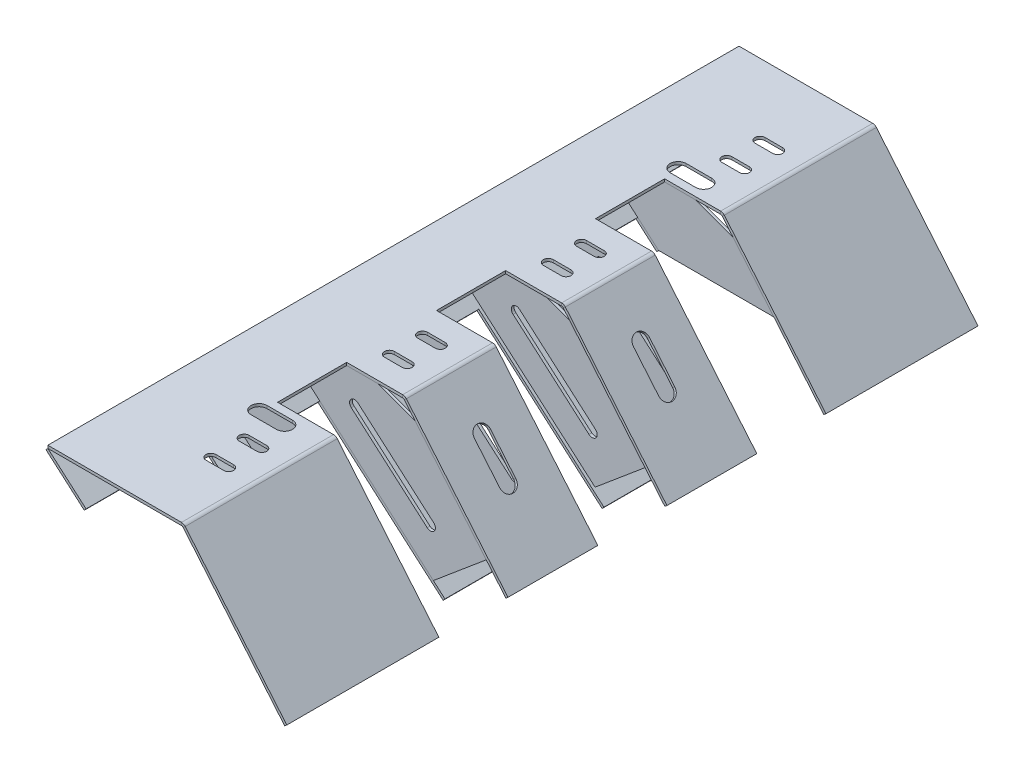
from build123d import *

# Parameters (mm, degrees)
SKETCH_1_W                  = 50
SKETCH_1_H                  = 250
SM_BASE_FLANGE_1_DEPTH      = 1
SM_START                    = -125
SM_EDGE_FLANGE_1_DEPTH      = 250
SM_EDGE_FLANGE_1_2_DEPTH    = 250
SKETCH_9_W                  = 58.348699919
SKETCH_9_H                  = 25
CUT_EXTRUDE_1_DEPTH         = 159.521065467
SM_BASE_FLANGE_2_DEPTH      = 1
SKETCH_20_W                 = 120
SKETCH_20_H                 = 250
SM_BASE_FLANGE_3_DEPTH      = 1
PATTERN_LINEAR_1_COUNT      = 2
PATTERN_LINEAR_1_PITCH      = 30.5
CUT_EXTRUDE_2_DEPTH         = 1
HOLE_START                  = -1
HOLE_WIZARD_M5_1_DEPTH      = 1
HOLE_WIZARD_M3_4_DEPTH      = 1
HOLE_WIZARD_M3_3_AT_2_COUNT = 2
HOLE_WIZARD_M3_3_AT_2_PITCH = 14.3
HOLE_START_2                = 36.659434546
HOLE_WIZARD_M5_3_DEPTH      = 1
SM_BASE_FLANGE_4_DEPTH      = 1
HOLE_START_3                = 44
HOLE_WIZARD_M3_10_DEPTH     = 1
PATTERN_START               = 13.5
PATTERN_LINEAR_2_DEPTH      = 1


# Read off the part's stored shape, not the designer's step: 边线-法兰1, M5 间隙槽口1, M3 间隙槽口4, M5 间隙槽口3, M3 间隙槽口10, 阵列(线性)2
# Sheet-metal steps are written as plain solids
with BuildPart() as part:
    # Sketch 1 → 基体-法兰1 (new body)
    with BuildSketch(Plane(origin=(0, 0, 0), x_dir=(1, 0, 0), z_dir=(0, 1, 0))):
        with Locations((25, 0)):
            Rectangle(SKETCH_1_W, SKETCH_1_H)
    extrude(amount=-SM_BASE_FLANGE_1_DEPTH)

    # 边线-法兰1 outline → 边线-法兰1 (cut)
    with BuildSketch(Plane.XY.offset(SM_START)):
        with BuildLine():
            ThreePointArc((48.35111049, 0), (49.085029363, -0.162705897), (49.68142327, -0.620335037))
            Line((49.68142327, -0.620335037), (50, -1))
            Line((50, -1), (50, 0))
            Line((50, 0), (48.35111049, 0))
        make_face()
    extrude(amount=SM_EDGE_FLANGE_1_DEPTH, mode=Mode.SUBTRACT)

    # Sm Edge Flange 1 2 outline → Sm Edge Flange 1 2 (add)
    with BuildSketch(Plane.XY.offset(SM_START)):
        with BuildLine():
            Line((86.442581731, -44.430577701), (50, -1))
            Line((50, -1), (48.35111049, -1))
            ThreePointArc((48.35111049, -1), (48.662411101, -1.069013684), (48.915378826, -1.263122647))
            Line((48.915378826, -1.263122647), (85.676537288, -45.073365311))
            Line((85.676537288, -45.073365311), (86.442581731, -44.430577701))
        make_face()
    extrude(amount=SM_EDGE_FLANGE_1_2_DEPTH)

    # Sketch 9 → 切除-拉伸1 (cut, through all)
    with BuildSketch(Plane(origin=(0, 0, 0), x_dir=(1, 0, 0), z_dir=(0, 1, 0))):
        with Locations((57.268231772, -57.5)):
            Rectangle(SKETCH_9_W, SKETCH_9_H)
        with Locations((57.268231772, 57.5)):
            Rectangle(SKETCH_9_W, SKETCH_9_H)
        with Locations((57.268231772, 0)):
            Rectangle(SKETCH_9_W, SKETCH_9_H)
    extrude(amount=-CUT_EXTRUDE_1_DEPTH, mode=Mode.SUBTRACT)

    # M5 间隙槽口1 outline → M5 间隙槽口1 (cut)
    with BuildSketch(Plane(origin=(0, 0, 0), x_dir=(1, 0, 0), z_dir=(0, 1, 0)).offset(HOLE_START)):
        with BuildLine():
            Line((27.20031184, -78.7), (36.40031184, -78.7))
            ThreePointArc((36.40031184, -78.7), (39.30031184, -75.8), (36.40031184, -72.9))
            Line((36.40031184, -72.9), (27.20031184, -72.9))
            ThreePointArc((27.20031184, -72.9), (24.30031184, -75.8), (27.20031184, -78.7))
        make_face()
    hole_wizard_m5_1 = extrude(amount=HOLE_WIZARD_M5_1_DEPTH, mode=Mode.SUBTRACT)

    # M3 间隙槽口4 outline → M3 间隙槽口4 (cut)
    with BuildSketch(Plane(origin=(0, 0, 0), x_dir=(1, 0, 0), z_dir=(0, 1, 0)).offset(HOLE_START)):
        with BuildLine():
            Line((33.3, -101.1), (39.7, -101.1))
            ThreePointArc((39.7, -101.1), (41.5, -99.3), (39.7, -97.5))
            Line((39.7, -97.5), (33.3, -97.5))
            ThreePointArc((33.3, -97.5), (31.5, -99.3), (33.3, -101.1))
        make_face()
        with BuildLine():
            Line((33.3, -89.1), (39.7, -89.1))
            ThreePointArc((39.7, -89.1), (41.5, -87.3), (39.7, -85.5))
            Line((39.7, -85.5), (33.3, -85.5))
            ThreePointArc((33.3, -85.5), (31.5, -87.3), (33.3, -89.1))
        make_face()
        with BuildLine():
            Line((33.3, -24.55), (39.7, -24.55))
            ThreePointArc((39.7, -24.55), (41.5, -22.75), (39.7, -20.95))
            Line((39.7, -20.95), (33.3, -20.95))
            ThreePointArc((33.3, -20.95), (31.5, -22.75), (33.3, -24.55))
        make_face()
        with BuildLine():
            Line((33.3, -36.55), (39.7, -36.55))
            ThreePointArc((39.7, -36.55), (41.5, -34.75), (39.7, -32.95))
            Line((39.7, -32.95), (33.3, -32.95))
            ThreePointArc((33.3, -32.95), (31.5, -34.75), (33.3, -36.55))
        make_face()
    hole_wizard_m3_4 = extrude(amount=HOLE_WIZARD_M3_4_DEPTH, mode=Mode.SUBTRACT)

    # 镜向3: M3 间隙槽口4 across plane
    add(hole_wizard_m3_4.mirror(Plane.XY), mode=Mode.SUBTRACT)

    # M5 间隙槽口3 outline → M5 间隙槽口3 (cut)
    with BuildSketch(Plane(origin=(0, 0, 0), x_dir=(0.6427876096865428, -0.7660444431189751, 0), z_dir=(0.766044443118975, 0.642787609686543, 0)).offset(HOLE_START_2)):
        with BuildLine():
            Line((50.000017638, -31.65), (64.200017638, -31.65))
            ThreePointArc((64.200017638, -31.65), (67.100017638, -28.75), (64.200017638, -25.85))
            Line((64.200017638, -25.85), (50.000017638, -25.85))
            ThreePointArc((50.000017638, -25.85), (47.100017638, -28.75), (50.000017638, -31.65))
        make_face()
    hole_wizard_m5_3 = extrude(amount=HOLE_WIZARD_M5_3_DEPTH, mode=Mode.SUBTRACT)

    # 镜向4: M5 间隙槽口3 across plane
    add(hole_wizard_m5_3.mirror(Plane.XY), mode=Mode.SUBTRACT)

    # 镜向6: M5 间隙槽口1 across plane
    add(hole_wizard_m5_1.mirror(Plane.XY), mode=Mode.SUBTRACT)


with BuildPart() as body_2:
    # 草图11 → 基体-法兰2 (new body)
    with BuildSketch(Plane.XY.offset(45)):
        Polygon((11.616737362, -1), (39.152703769, -1), (52.890090867, -6), (78.582433732, -36.618941912), (59.446407977, -52.675974065), (6.616737362, -6.751842036), align=None)
    extrude(amount=-SM_BASE_FLANGE_2_DEPTH)


with BuildPart() as body_3:
    # 草图20 → 基体-法兰3 (new body)
    with BuildSketch(Plane(origin=(-0.495134034, -0.56958655, 0), x_dir=(0.7547095802227757, -0.6560590289905031, 0), z_dir=(-0.6560590289905032, -0.7547095802227757, 0))):
        with Locations((60.656059029, 0)):
            Rectangle(SKETCH_20_W, SKETCH_20_H)
    extrude(amount=SM_BASE_FLANGE_3_DEPTH)

    # 草图23 → M3 间隙孔1 (revolve, cut)
    with BuildSketch(Plane(origin=(16.961836862, -17.069712826, 75.8), x_dir=(0.7547095802227757, -0.6560590289905033, 0), z_dir=(0, 0, 1))):
        Polygon((0, 0), (0, 9.581549114), (1.8, 8.5), (1.8, 0), align=None)
    hole_wizard_m3_1 = revolve(axis=Axis((12.795862028, -21.862118661, 75.8), (0.6560590289905031, 0.7547095802227756, 0)), mode=Mode.SUBTRACT)

    # 草图24 → 切除-拉伸2 (cut)
    with BuildSketch(Plane(origin=(-1.151193063, -1.324296131, 0), x_dir=(0.7547095802227756, -0.6560590289905033, 0), z_dir=(-0.6560590289905033, -0.7547095802227757, 0))):
        Polygon((120.656059029, 125), (19, 125), (19, 83), (35, 83), (35, 70), (25, 70), (25, 45), (85, 45), (85, 12.5), (25, 12.5), (25, -12.5), (85, -12.5), (85, -45), (25, -45), (25, -70), (35, -70), (35, -83), (19, -83), (19, -125), (120.656059029, -125), align=None)
    extrude(amount=-CUT_EXTRUDE_2_DEPTH, mode=Mode.SUBTRACT)

    # 草图31 → M3 间隙孔3 (revolve, cut)
    with BuildSketch(Plane(origin=(41.489898219, -38.391631269, 28.75), x_dir=(0.7547095802227755, -0.6560590289905034, 0), z_dir=(0, 0, 1))):
        Polygon((0, 0), (0, 18.081549114), (1.8, 17), (1.8, 0), align=None)
    hole_wizard_m3_3 = revolve(axis=Axis((37.323923385, -43.184037103, 28.75), (0.6560590289905035, 0.7547095802227755, 0)), mode=Mode.SUBTRACT)

    # M3 间隙孔3 at 2: M3 间隙孔3 ×2
    with Locations(*[Vector(0.7547095802227753, -0.6560590289905036, 0) * (i * HOLE_WIZARD_M3_3_AT_2_PITCH) for i in range(1, HOLE_WIZARD_M3_3_AT_2_COUNT)]):
        add(hole_wizard_m3_3, mode=Mode.SUBTRACT)

    # 镜向2: M3 间隙孔1, M3 间隙孔3 across plane
    add(hole_wizard_m3_1.mirror(Plane.XY), mode=Mode.SUBTRACT)
    add(hole_wizard_m3_3.mirror(Plane.XY), mode=Mode.SUBTRACT)

    # 镜向2 copy 1 sketch → 镜向2 copy 1 (revolve, cut)
    with BuildSketch(Plane(origin=(52.282245216, -47.773275383, -28.75), x_dir=(0.7547095802227755, -0.6560590289905034, 0), z_dir=(0, 0, -1))):
        Polygon((0, 0), (0, -18.081549114), (1.8, -17), (1.8, 0), align=None)
    revolve(axis=Axis((48.116270382, -52.565681218, -28.75), (-0.6560590289905035, -0.7547095802227755, 0)), mode=Mode.SUBTRACT)


with BuildPart() as pattern_linear_1_1:
    # 阵列(线性)1: pattern copy
    add(body_2.part.moved(Location(Vector(0, 0, -1) * (1 * PATTERN_LINEAR_1_PITCH))))


with BuildPart() as body_5:
    # 镜向1: mirrored copy
    add(body_2.part.mirror(Plane.XY))


with BuildPart() as body_6:
    # Mirror 1 2: mirrored copy
    add(pattern_linear_1_1.part.mirror(Plane.XY))


with BuildPart() as body_7:
    # 草图35 → 基体-法兰4 (new body)
    with BuildSketch(Plane(origin=(0, 0, 70), x_dir=(-1, 0, 0), z_dir=(0, 0, -1))):
        Polygon((-11.616737362, -1), (-39.152703769, -1), (-52.890090867, -6), (-67.600894068, -23.531652565), (-25.919701273, -23.531652565), (-6.616737362, -6.751842036), align=None)
    extrude(amount=-SM_BASE_FLANGE_4_DEPTH)


with BuildPart() as body_8:
    # 镜向5: mirrored copy
    add(body_7.part.mirror(Plane.XY))


with BuildPart() as body_2_1:
    add(body_2.part)

    # M3 间隙槽口10 outline → M3 间隙槽口10 (cut)
    with BuildSketch(Plane.XY.offset(HOLE_START_3)):
        with BuildLine():
            Line((29.761208306, -13.35589115), (57.232637026, -37.236439805))
            ThreePointArc((57.232637026, -37.236439805), (59.772020523, -37.058868813), (59.594449531, -34.519485316))
            Line((59.594449531, -34.519485316), (32.123020811, -10.638936661))
            ThreePointArc((32.123020811, -10.638936661), (29.583637314, -10.816507653), (29.761208306, -13.35589115))
        make_face()
    hole_wizard_m3_10 = extrude(amount=HOLE_WIZARD_M3_10_DEPTH, mode=Mode.SUBTRACT)


with BuildPart() as pattern_linear_1_1_1:
    add(pattern_linear_1_1.part)

    # 阵列(线性)2 outline → 阵列(线性)2 (cut)
    with BuildSketch(Plane.XY.offset(PATTERN_START)):
        with BuildLine():
            Line((29.761208306, -13.35589115), (57.232637026, -37.236439805))
            ThreePointArc((57.232637026, -37.236439805), (59.772020523, -37.058868813), (59.594449531, -34.519485316))
            Line((59.594449531, -34.519485316), (32.123020811, -10.638936661))
            ThreePointArc((32.123020811, -10.638936661), (29.583637314, -10.816507653), (29.761208306, -13.35589115))
        make_face()
    pattern_linear_2 = extrude(amount=PATTERN_LINEAR_2_DEPTH, mode=Mode.SUBTRACT)


with BuildPart() as mirror_9_tool:
    # 镜向9: M3 间隙槽口10, 阵列(线性)2 across plane
    add(hole_wizard_m3_10.mirror(Plane.XY))
    add(pattern_linear_2.mirror(Plane.XY))


with BuildPart() as body_5_1:
    add(body_5.part)

    # 镜向9: cut by mirror_9_tool
    add(mirror_9_tool.part, mode=Mode.SUBTRACT)


with BuildPart() as body_6_1:
    add(body_6.part)

    # 镜向9: cut by mirror_9_tool
    add(mirror_9_tool.part, mode=Mode.SUBTRACT)


solid = Compound([part.part, body_3.part, body_7.part, body_8.part, body_2_1.part, pattern_linear_1_1_1.part, body_5_1.part, body_6_1.part])
